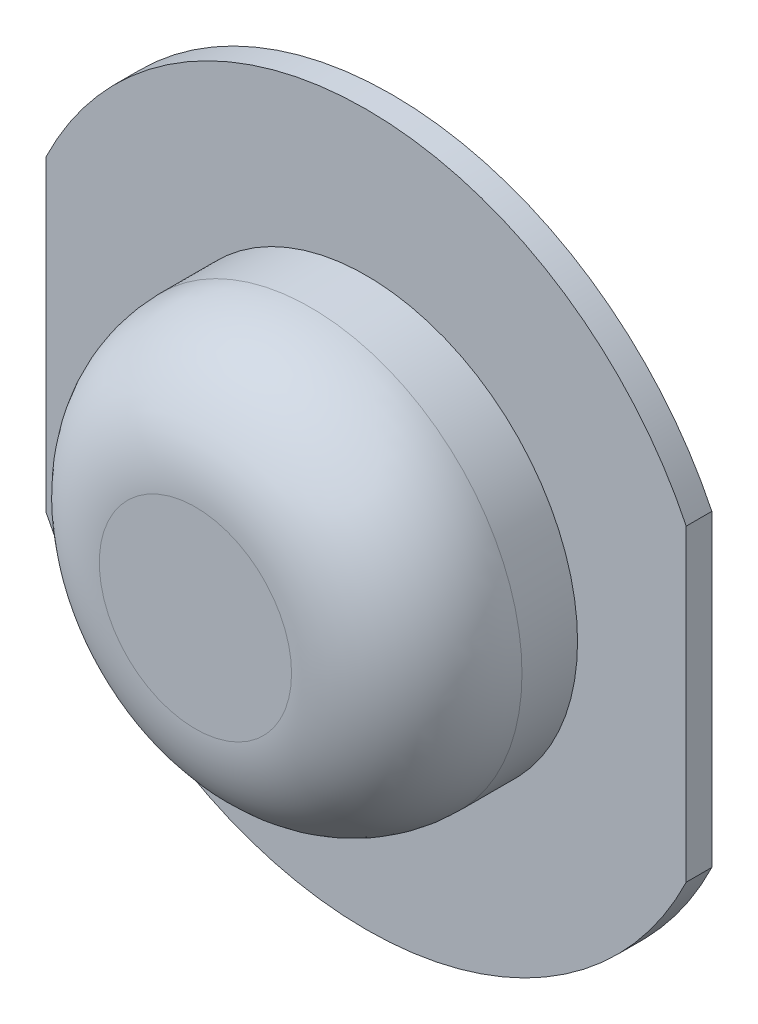
from build123d import *

# Parameters (mm, degrees)
BOSS_EXTRUDE1_DEPTH = 4
SKETCH6_W           = 52.54
SKETCH6_H           = 52.54
CUT_EXTRUDE2_DEPTH  = 2.35
CUT_EXTRUDE3_DEPTH  = 0.8
CIRPATTERN1_COUNT   = 4
SKETCH9_R           = 33.02
BOSS_EXTRUDE3_DEPTH = 26.68
FILLET2_R           = 18


with BuildPart() as part:
    # Sketch1 → Boss-Extrude1 (new body)
    with BuildSketch(Plane.XY):
        with BuildLine():
            Line((50, 24.088378941), (50, -24.088378941))
            ThreePointArc((50, -24.088378941), (0, -55.5), (-50, -24.088378941))
            Line((-50, -24.088378941), (-50, 24.088378941))
            ThreePointArc((-50, 24.088378941), (0, 55.5), (50, 24.088378941))
        make_face()
    extrude(amount=BOSS_EXTRUDE1_DEPTH)

    # Sketch6 → Cut-Extrude2 (cut)
    with BuildSketch(Plane(origin=(0, 0, 0), x_dir=(-1, 0, 0), z_dir=(0, 0, -1))):
        Rectangle(SKETCH6_W, SKETCH6_H)
    extrude(amount=-CUT_EXTRUDE2_DEPTH, mode=Mode.SUBTRACT)

    # Sketch7 → Cut-Revolve1 (revolve, cut)
    with BuildSketch(Plane(origin=(0, 0, 0), x_dir=(1, 0, 0), z_dir=(0, 1, 0))):
        with BuildLine():
            Line((0, -2.35), (0, -27.35))
            ThreePointArc((0, -27.35), (17.67766953, -20.02766953), (25, -2.35))
            Line((25, -2.35), (0, -2.35))
        make_face()
    revolve(axis=Axis((0, 0, 2.35), (0, 0, 1)), mode=Mode.SUBTRACT)

    # Sketch8 → Cut-Extrude3 (cut)
    with BuildSketch(Plane(origin=(0, 0, 2.35), x_dir=(-1, 0, 0), z_dir=(0, 0, -1))):
        with BuildLine():
            Line((-19.887048211, -15.149432777), (-15.149432777, -19.887048211))
            Line((-15.149432777, -19.887048211), (-17.801083206, -22.53869864))
            ThreePointArc((-17.801083206, -22.53869864), (-19.215296769, -23.124485078), (-20.629510331, -22.53869864))
            Line((-20.629510331, -22.53869864), (-22.53869864, -20.629510331))
            ThreePointArc((-22.53869864, -20.629510331), (-23.124485078, -19.215296769), (-22.53869864, -17.801083206))
            Line((-22.53869864, -17.801083206), (-19.887048211, -15.149432777))
        make_face()
    cut_extrude3 = extrude(amount=-CUT_EXTRUDE3_DEPTH, mode=Mode.SUBTRACT)

    # CirPattern1: Cut-Extrude3 ×4 about axis
    cirpattern1_axis = Axis((0, 0, 0), (0, 0, 1))
    for i in range(1, CIRPATTERN1_COUNT):
        add(cut_extrude3.rotate(cirpattern1_axis, i * 360 / CIRPATTERN1_COUNT), mode=Mode.SUBTRACT)

    # Sketch9 → Boss-Extrude3 (add)
    with BuildSketch(Plane.XY.offset(4)):
        Circle(SKETCH9_R)
    extrude(amount=BOSS_EXTRUDE3_DEPTH)

    # Fillet2
    fillet2_edges = [part.edges().sort_by_distance(p)[0] for p in [
        (-33.02, 0, 30.68),
    ]]
    fillet(fillet2_edges, radius=FILLET2_R)


solid = part.part
